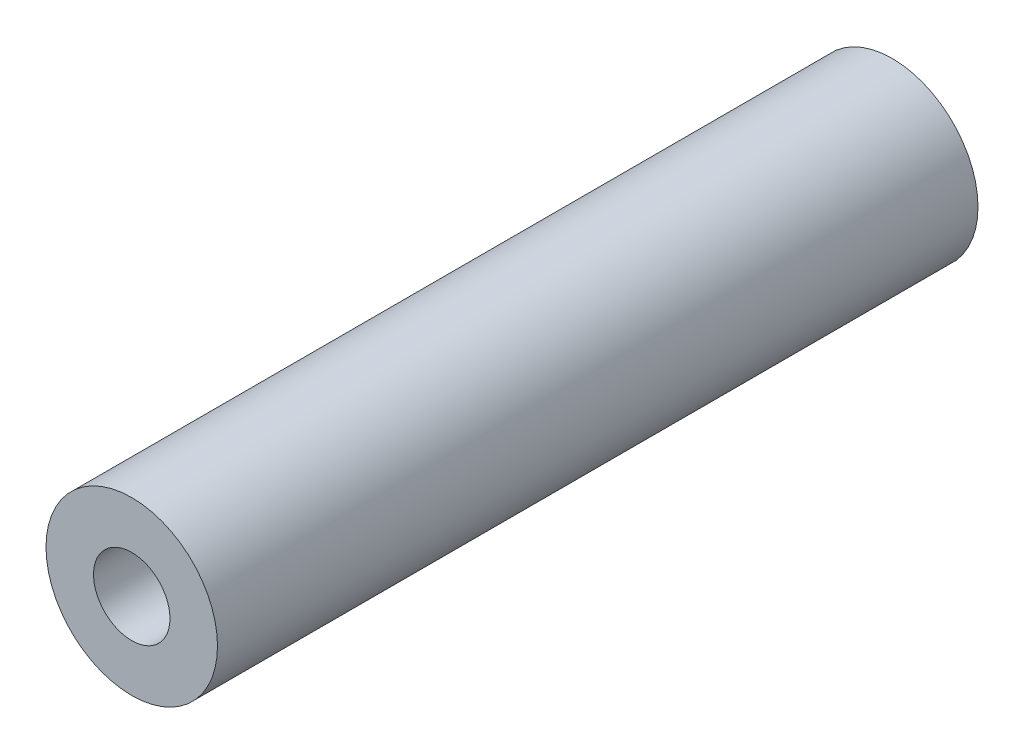
from build123d import *

# Parameters (mm, degrees)
SKETCH1_R           = 5.7277
SKETCH1_R_2         = 2.5527
BOSS_EXTRUDE1_DEPTH = 50.8


with BuildPart() as part:
    # Sketch1 → Boss-Extrude1 (new body)
    with BuildSketch(Plane.XY):
        Circle(SKETCH1_R)
        Circle(SKETCH1_R_2, mode=Mode.SUBTRACT)
    extrude(amount=BOSS_EXTRUDE1_DEPTH)


solid = part.part
